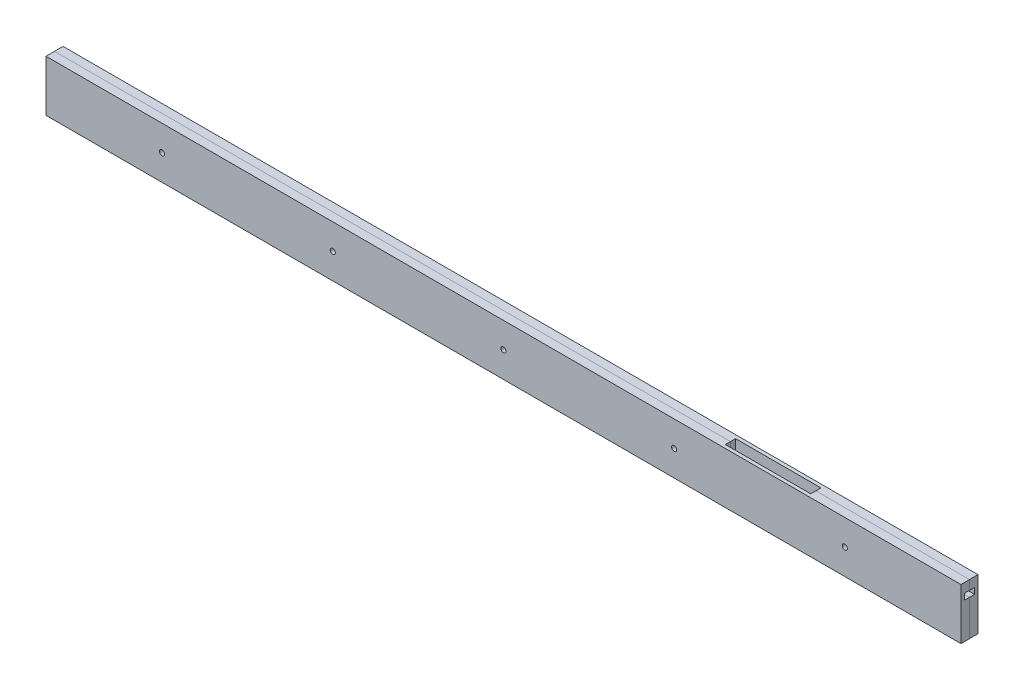
from build123d import *

# Parameters (mm, degrees)
SKETCH_1_W                         = 1072
SKETCH_1_H                         = 60
EXTRUDE_1_DEPTH                    = 5
CUT_EXTRUDE_1_DEPTH                = 6
SKETCH_3_R                         = 3
CUT_EXTRUDE_2_DEPTH                = 537.932025493
CHAMFER_1_SIZE                     = 2
PATTERN_LINEAR_1_COUNT             = 5
PATTERN_LINEAR_1_PITCH             = 200
CHAMFER_1_OF_PATTERN_LINEAR_1_SIZE = 2


with BuildPart() as part:
    # Эскиз1 → Бобышка-Вытянуть1 (new, symmetric)
    with BuildSketch(Plane.XY):
        Rectangle(SKETCH_1_W, SKETCH_1_H)
    extrude(amount=EXTRUDE_1_DEPTH, both=True)

    # Эскиз2 → Вырез-Вытянуть1 (cut)
    with BuildSketch(Plane.XY.offset(5)):
        with BuildLine():
            Line((-292.5, 19), (256, 19))
            Line((256, 19), (256, 30))
            Line((256, 30), (356, 30))
            Line((356, 30), (356, 19))
            Line((356, 19), (536, 19))
            Line((536, 19), (536, 12))
            Line((536, 12), (356, 12))
            Line((356, 12), (356, -30))
            Line((356, -30), (256, -30))
            Line((256, -30), (256, 12))
            Line((256, 12), (-292.5, 12))
            ThreePointArc((-292.5, 12), (-296, 15.5), (-292.5, 19))
        make_face()
    extrude(amount=-CUT_EXTRUDE_1_DEPTH, mode=Mode.SUBTRACT)

    # Эскиз3 → Вырез-Вытянуть2 (cut, through all)
    with BuildSketch(Plane.XY.offset(5)):
        with Locations((400, 0)):
            Circle(SKETCH_3_R)
    cut_extrude_2 = extrude(amount=-CUT_EXTRUDE_2_DEPTH, mode=Mode.SUBTRACT)

    # Фаска1
    chamfer_1_edges = [part.edges().sort_by_distance(p)[0] for p in [
        (397, 0, 5),
    ]]
    chamfer(chamfer_1_edges, length=CHAMFER_1_SIZE)

    # Линейный массив1: Вырез-Вытянуть2 ×5
    with Locations(*[(-i * PATTERN_LINEAR_1_PITCH, 0, 0) for i in range(1, PATTERN_LINEAR_1_COUNT)]):
        add(cut_extrude_2, mode=Mode.SUBTRACT)

    # Фаска1 of Линейный массив1
    chamfer_1_of_pattern_linear_1_edges = [part.edges().sort_by_distance(p)[0] for p in [
        (197, 0, 5),
        (-3, 0, 5),
        (-203, 0, 5),
        (-403, 0, 5),
    ]]
    chamfer(chamfer_1_of_pattern_linear_1_edges, length=CHAMFER_1_OF_PATTERN_LINEAR_1_SIZE)


with BuildPart() as body_2:
    # Зеркальное отражение1: mirrored copy
    add(part.part.mirror(Plane(origin=(0, 0, 5), x_dir=(1, 0, 0), z_dir=(0, 0, -1))))


solid = Compound([part.part, body_2.part])
